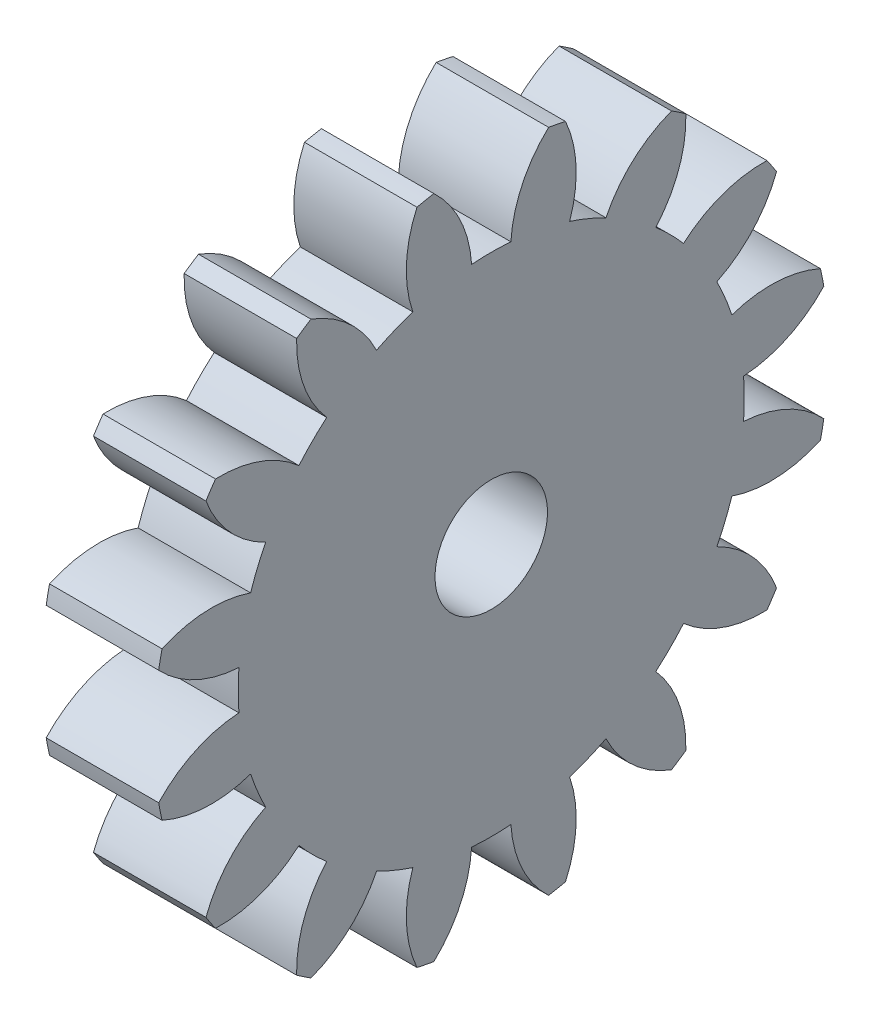
from build123d import *

# Parameters (mm, degrees)
BASPROSKE_W     = 3
BASPROSKE_H     = 9
TOOTHCUT_DEPTH  = 14.076696831
TEETHCUTS_COUNT = 16
TEETHCUTS_ANGLE = 337.5
BORSKE_R        = 1.5
BORE_DEPTH      = 15.0000508


with BuildPart() as part:
    # BasProSke → Base-Revolve (revolve)
    with BuildSketch(Plane(origin=(0, 0, 0), x_dir=(1, 0, 0), z_dir=(0, 1, 0))):
        with Locations((1.5, 4.5)):
            Rectangle(BASPROSKE_W, BASPROSKE_H)
    revolve(axis=Axis((-10, 0, 0), (1, 0, 0)))

    # TooCutSke → ToothCut (cut, through all)
    with BuildSketch(Plane(origin=(0, 0, 0), x_dir=(0, 0, -1), z_dir=(1, 0, 0))):
        with BuildLine():
            ThreePointArc((0.523792937, 6.728643397), (0, 6.749), (-0.523792937, 6.728643397))
            ThreePointArc((-0.523792937, 6.728643397), (-0.828704482, 7.90962059), (-1.553355277, 8.890721711))
            ThreePointArc((-1.553355277, 8.890721711), (0, 9.0254), (1.553355277, 8.890721711))
            ThreePointArc((1.553355277, 8.890721711), (0.828704482, 7.90962059), (0.523792937, 6.728643397))
        make_face()
    toothcut = extrude(amount=TOOTHCUT_DEPTH, mode=Mode.SUBTRACT)

    # TeethCuts: ToothCut ×16 about axis
    teethcuts_axis = Axis((-10, 0, 0), (1, 0, 0))
    for i in range(1, TEETHCUTS_COUNT):
        add(toothcut.rotate(teethcuts_axis, i * TEETHCUTS_ANGLE / (TEETHCUTS_COUNT - 1)), mode=Mode.SUBTRACT)

    # BorSke → Bore (cut, symmetric)
    with BuildSketch(Plane(origin=(0, 0, 0), x_dir=(0, 0, -1), z_dir=(1, 0, 0))):
        Circle(BORSKE_R)
    extrude(amount=BORE_DEPTH, both=True, mode=Mode.SUBTRACT)


solid = part.part
